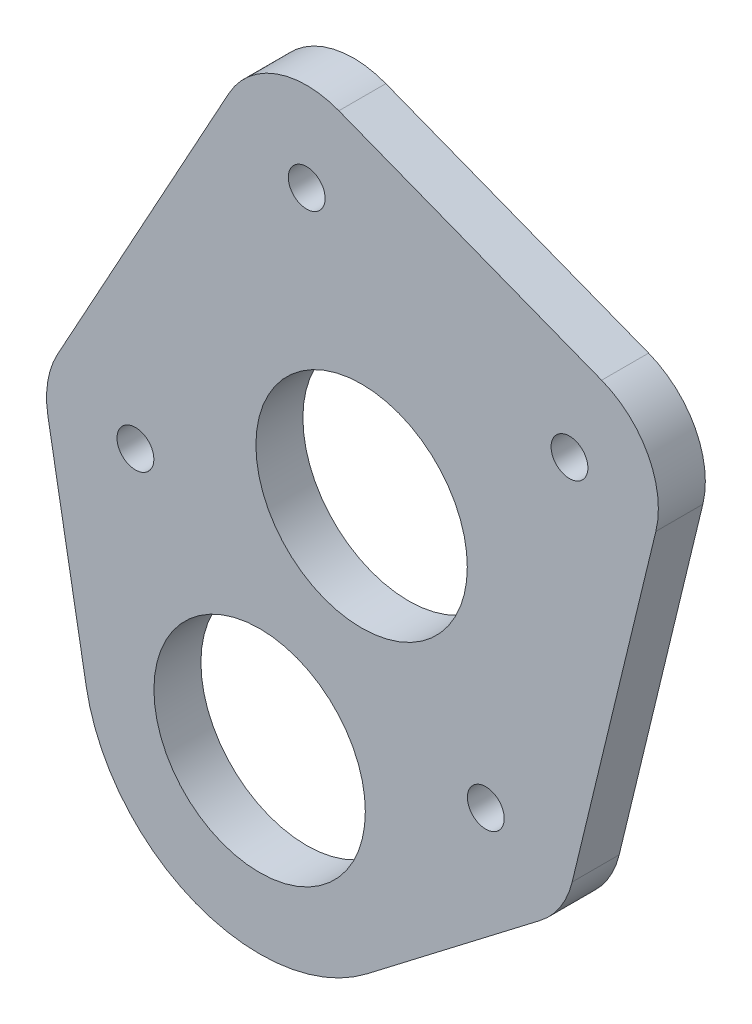
from build123d import *

# Parameters (mm, degrees)
SKETCH1_R           = 14.2875
SKETCH1_R_2         = 2.4892
BOSS_EXTRUDE1_DEPTH = 3.175


with BuildPart() as part:
    # Sketch1 → Boss-Extrude1 (new, symmetric)
    with BuildSketch(Plane.XY):
        with BuildLine():
            Line((-28.615178949, 24.840879756), (-23.443060949, -4.178283093))
            ThreePointArc((-23.443060949, -4.178283093), (-8.615059742, -22.199457243), (14.487631443, -18.898245724))
            Line((14.487631443, -18.898245724), (37.880961837, -0.964626173))
            ThreePointArc((37.880961837, -0.964626173), (40.639358256, 2.014361798), (42.248045108, 5.741994659))
            Line((42.248045108, 5.741994659), (53.558309328, 52.438258409))
            ThreePointArc((53.558309328, 52.438258409), (52.529991519, 60.830207619), (46.228317882, 66.466798647))
            Line((46.228317882, 66.466798647), (10.709186293, 80.250894235))
            ThreePointArc((10.709186293, 80.250894235), (2.254945789, 80.340708158), (-4.165053134, 74.839266268))
            Line((-4.165053134, 74.839266268), (-27.315027884, 32.737701046))
            ThreePointArc((-27.315027884, 32.737701046), (-28.641975661, 28.900732225), (-28.615178949, 24.840879756))
        make_face()
        Circle(SKETCH1_R, mode=Mode.SUBTRACT)
        with Locations((13.784095588, 35.519131589)):
            Circle(SKETCH1_R, mode=Mode.SUBTRACT)
        with Locations((-16.787373265, 26.948962853)):
            Circle(SKETCH1_R_2, mode=Mode.SUBTRACT)
        with Locations((30.571468853, 8.570168736)):
            Circle(SKETCH1_R_2, mode=Mode.SUBTRACT)
        with Locations((41.881733073, 55.266432486)):
            Circle(SKETCH1_R_2, mode=Mode.SUBTRACT)
        with Locations((6.362601485, 69.050528074)):
            Circle(SKETCH1_R_2, mode=Mode.SUBTRACT)
    extrude(amount=BOSS_EXTRUDE1_DEPTH, both=True)


solid = part.part
